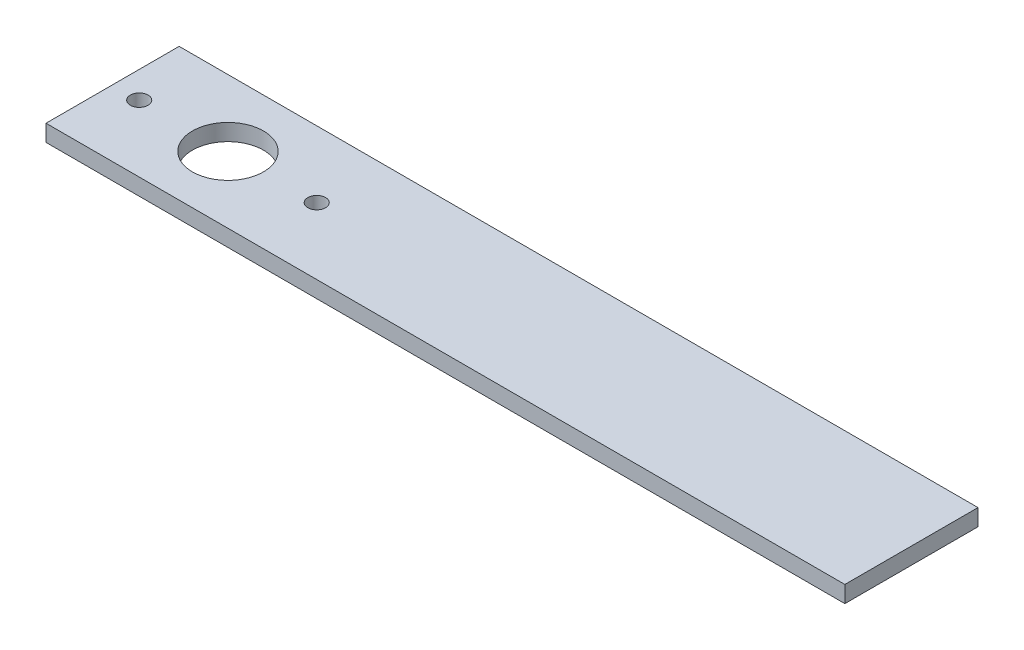
from build123d import *

# Parameters (mm, degrees)
SKETCH3_W          = 228.6
SKETCH3_H          = 38.1
SKETCH3_R          = 2.54
SKETCH3_R_2        = 10.16
BASE_FLANGE1_DEPTH = 4.7625


# Sheet-metal steps are written as plain solids
with BuildPart() as part:
    # Sketch3 → Base-Flange1 (new body)
    with BuildSketch(Plane(origin=(0, 0, 0), x_dir=(1, 0, 0), z_dir=(0, 1, 0))):
        with Locations((-114.3, 0)):
            Rectangle(SKETCH3_W, SKETCH3_H)
        with Locations(Location((-220.98, 0, 0), (0, 0, 270))):
            Circle(SKETCH3_R, mode=Mode.SUBTRACT)
        with Locations(Location((-195.58, 0, 0), (0, 0, 270))):
            Circle(SKETCH3_R_2, mode=Mode.SUBTRACT)
        with Locations(Location((-170.18, 0, 0), (0, 0, 270))):
            Circle(SKETCH3_R, mode=Mode.SUBTRACT)
    extrude(amount=-BASE_FLANGE1_DEPTH)


solid = part.part
